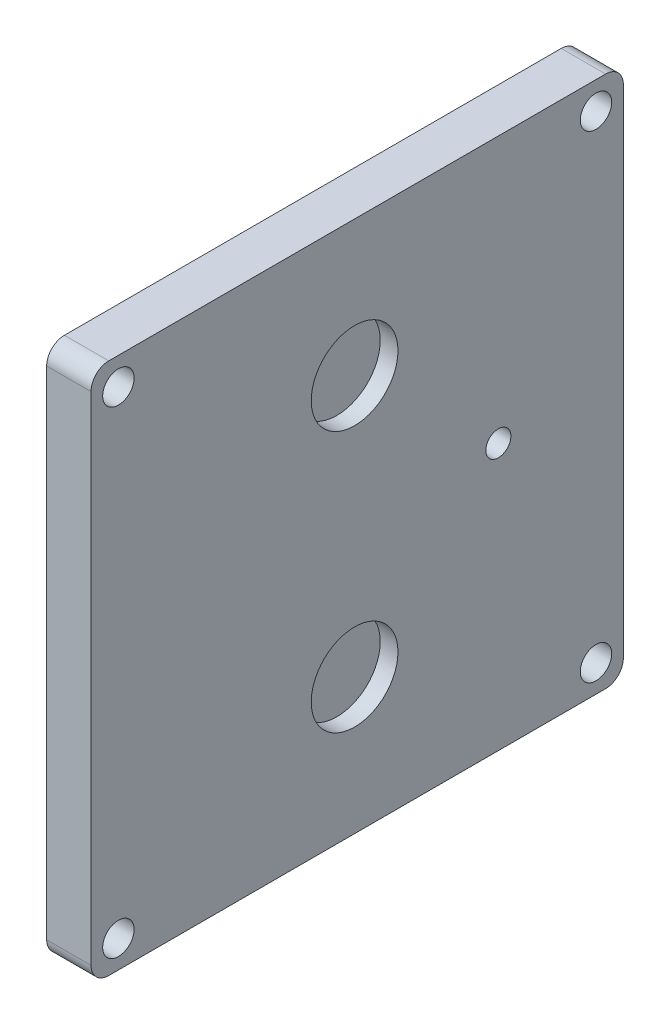
from build123d import *

# Parameters (mm, degrees)
BOSS_EXTRUDE1_DEPTH      = 6.35
SKETCH6_R                = 1.778
CUT_EXTRUDE1_DEPTH       = 55.254423783
SKETCH3_R                = 6.21
CUT_EXTRUDE5_DEPTH       = 2.54
SKETCH17_W               = 63.5
SKETCH17_H               = 63.5
BOSS_EXTRUDE2_DEPTH      = 2.54
FILLET1_R                = 2.54
SKETCH18_R               = 1.796498268
CUT_EXTRUDE6_DEPTH       = 55.61
M4_CLEARANCE_HOLE1_D     = 4.5
M4_CLEARANCE_HOLE1_DEPTH = 13.97
M4_CLEARANCE_HOLE1_TIP   = 1.351936393
SKETCH24_W               = 50.8
SKETCH24_H               = 3.81
CUT_EXTRUDE7_DEPTH       = 5.08
FILLET3_R                = 1.27


with BuildPart() as part:
    # Sketch2 → Boss-Extrude1 (new body)
    with BuildSketch(Plane(origin=(0, 0, 0), x_dir=(0, 0, -1), z_dir=(1, 0, 0))):
        with BuildLine():
            Line((-35.56, -38.1), (35.56, -38.1))
            ThreePointArc((35.56, -38.1), (37.356051224, -37.356051224), (38.1, -35.56))
            Line((38.1, -35.56), (38.1, 35.56))
            ThreePointArc((38.1, 35.56), (37.356051224, 37.356051224), (35.56, 38.1))
            Line((35.56, 38.1), (-35.56, 38.1))
            ThreePointArc((-35.56, 38.1), (-37.356051224, 37.356051224), (-38.1, 35.56))
            Line((-38.1, 35.56), (-38.1, -35.56))
            ThreePointArc((-38.1, -35.56), (-37.356051224, -37.356051224), (-35.56, -38.1))
        make_face()
    extrude(amount=BOSS_EXTRUDE1_DEPTH)

    # Sketch6 → Cut-Extrude1 (cut, through all)
    with BuildSketch(Plane(origin=(6.35, 0, 0), x_dir=(0, 0, -1), z_dir=(1, 0, 0))):
        with Locations((20.206289335, 0)):
            Circle(SKETCH6_R)
    extrude(amount=-CUT_EXTRUDE1_DEPTH, mode=Mode.SUBTRACT)

    # Sketch3 → Cut-Extrude5 (cut)
    with BuildSketch(Plane(origin=(6.35, 0, 0), x_dir=(0, 0, -1), z_dir=(1, 0, 0))):
        with Locations((-0.371974388, -18.678025612)):
            Circle(SKETCH3_R)
        with Locations((-0.371974388, 18.678025612)):
            Circle(SKETCH3_R)
    extrude(amount=-CUT_EXTRUDE5_DEPTH, mode=Mode.SUBTRACT)

    # Sketch17 → Boss-Extrude2 (add)
    with BuildSketch(Plane.ZY):
        Rectangle(SKETCH17_W, SKETCH17_H)
    extrude(amount=BOSS_EXTRUDE2_DEPTH)

    # Fillet1
    fillet1_edges = [part.edges().sort_by_distance(p)[0] for p in [
        (-1.27, -31.75, 31.75),
        (-1.27, -31.75, -31.75),
        (-1.27, 31.75, -31.75),
        (-1.27, 31.75, 31.75),
    ]]
    fillet(fillet1_edges, radius=FILLET1_R)

    # Sketch18 → Cut-Extrude6 (cut, through all)
    with BuildSketch(Plane.ZY.offset(2.54)):
        with Locations((-20.206289335, 0)):
            Circle(SKETCH18_R)
    extrude(amount=-CUT_EXTRUDE6_DEPTH, mode=Mode.SUBTRACT)

    # M4 Clearance Hole1
    with Locations(Plane.ZY):
        with Locations((-34.181051224, 34.181051224), (34.181051224, 34.181051224), (34.181051224, -34.181051224), (-34.181051224, -34.181051224)):
            Hole(M4_CLEARANCE_HOLE1_D / 2, depth=M4_CLEARANCE_HOLE1_DEPTH)
            with Locations((0, 0, -(M4_CLEARANCE_HOLE1_DEPTH + M4_CLEARANCE_HOLE1_TIP / 2))):  # 118° drill point
                Cone(0, M4_CLEARANCE_HOLE1_D / 2, M4_CLEARANCE_HOLE1_TIP, mode=Mode.SUBTRACT)

    # Sketch24 → Cut-Extrude7 (cut)
    with BuildSketch(Plane.ZY.offset(2.54)):
        with Locations((0, -27.94)):
            Rectangle(SKETCH24_W, SKETCH24_H)
        with Locations((0, 27.94)):
            Rectangle(SKETCH24_W, SKETCH24_H)
    extrude(amount=-CUT_EXTRUDE7_DEPTH, mode=Mode.SUBTRACT)

    # Fillet3
    fillet3_edges = [part.edges().sort_by_distance(p)[0] for p in [
        (0, 29.845, -25.4),
        (0, 29.845, 25.4),
        (0, 26.035, 25.4),
        (0, 26.035, -25.4),
        (0, -29.845, -25.4),
        (0, -26.035, 25.4),
        (0, -29.845, 25.4),
        (0, -26.035, -25.4),
    ]]
    fillet(fillet3_edges, radius=FILLET3_R)


solid = part.part
